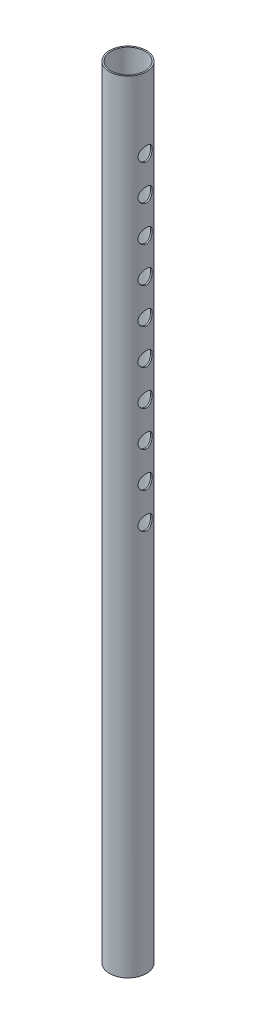
from build123d import *

# Parameters (mm, degrees)
SKETCH_2_R               = 13
SKETCH_2_R_2             = 12
CUT_EXTRUDE_1_DEPTH      = 551.307186942
CUT_EXTRUDE_1_DEPTH_BACK = 551.307186942
SKETCH_3_R               = 5


with BuildPart() as part:
    # По траектории1: sweep along a path in Эскиз1
    with BuildLine(Plane.XY) as sweep_1_path:
        Line((0, 0), (0, -550))
    # Эскиз2 → По траектории1 (sweep)
    with BuildSketch(Plane(origin=(0, 0, 0), x_dir=(1, 0, 0), z_dir=(0, 1, 0))):
        Circle(SKETCH_2_R)
        Circle(SKETCH_2_R_2, mode=Mode.SUBTRACT)
    sweep(path=sweep_1_path.line)

    # Эскиз3 → Вырез-Вытянуть1 (cut, two sides: drawn at the far end of the back side and taken through both)
    with BuildSketch(Plane(origin=(0, 0, 0), x_dir=(0, 0, -1), z_dir=(1, 0, 0)).offset(-CUT_EXTRUDE_1_DEPTH_BACK)):
        with Locations((0, -50)):
            Circle(SKETCH_3_R)
        with Locations((0, -75)):
            Circle(SKETCH_3_R)
        with Locations((0, -100)):
            Circle(SKETCH_3_R)
        with Locations((0, -125)):
            Circle(SKETCH_3_R)
        with Locations((0, -150)):
            Circle(SKETCH_3_R)
        with Locations((0, -175)):
            Circle(SKETCH_3_R)
        with Locations((0, -200)):
            Circle(SKETCH_3_R)
        with Locations((0, -225)):
            Circle(SKETCH_3_R)
        with Locations((0, -250)):
            Circle(SKETCH_3_R)
        with Locations((0, -275)):
            Circle(SKETCH_3_R)
    extrude(amount=CUT_EXTRUDE_1_DEPTH + CUT_EXTRUDE_1_DEPTH_BACK, mode=Mode.SUBTRACT)


solid = part.part
